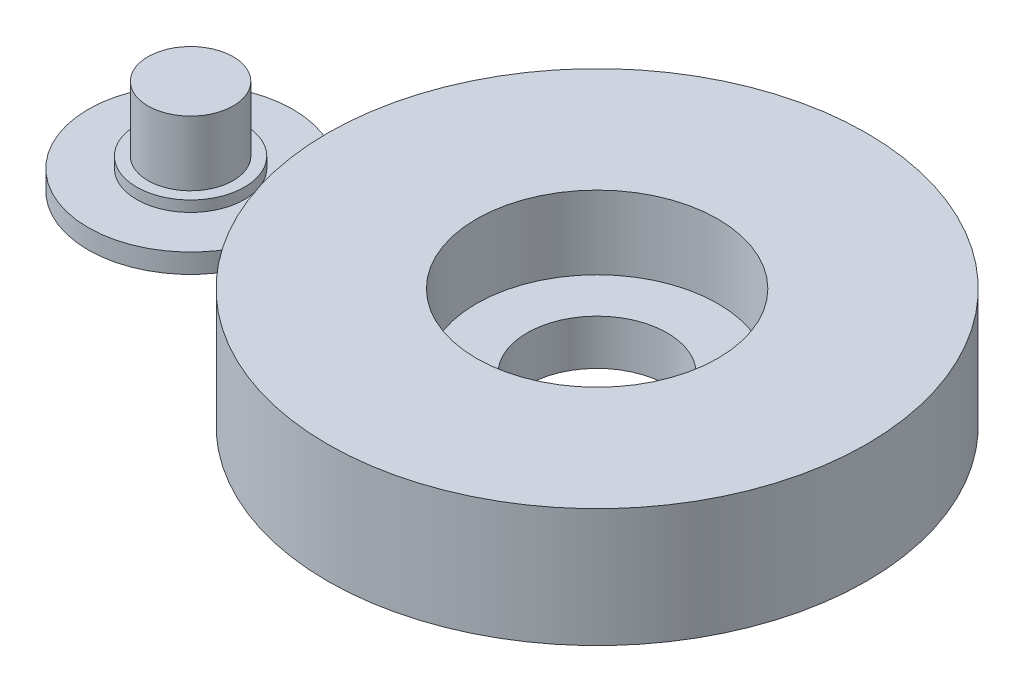
from build123d import *

# Parameters (mm, degrees)
SKETCH1_R           = 9.5
BOSS_EXTRUDE1_DEPTH = 1.8
SKETCH2_R           = 3.955
BOSS_EXTRUDE2_DEPTH = 7
SKETCH3_R           = 5
BOSS_EXTRUDE3_DEPTH = 1
SKETCH5_R           = 25
BOSS_EXTRUDE4_DEPTH = 11
SKETCH6_R           = 11.2
CUT_EXTRUDE1_DEPTH  = 6.8
SKETCH7_R           = 6.5
CUT_EXTRUDE2_DEPTH  = 6.8


with BuildPart() as part:
    # Sketch1 → Boss-Extrude1 (new body)
    with BuildSketch(Plane(origin=(0, 0, 0), x_dir=(1, 0, 0), z_dir=(0, 1, 0))):
        Circle(SKETCH1_R)
    extrude(amount=BOSS_EXTRUDE1_DEPTH)

    # Sketch2 → Boss-Extrude2 (add)
    with BuildSketch(Plane(origin=(0, 1.8, 0), x_dir=(1, 0, 0), z_dir=(0, 1, 0))):
        Circle(SKETCH2_R)
    extrude(amount=BOSS_EXTRUDE2_DEPTH)

    # Sketch3 → Boss-Extrude3 (add)
    with BuildSketch(Plane(origin=(0, 1.8, 0), x_dir=(1, 0, 0), z_dir=(0, 1, 0))):
        Circle(SKETCH3_R)
    extrude(amount=BOSS_EXTRUDE3_DEPTH)


with BuildPart() as body_2:
    # Sketch5 → Boss-Extrude4 (new body)
    with BuildSketch(Plane(origin=(0, 0, 0), x_dir=(1, 0, 0), z_dir=(0, 1, 0))):
        with Locations((37.713199052, 0)):
            Circle(SKETCH5_R)
    extrude(amount=BOSS_EXTRUDE4_DEPTH)

    # Sketch6 → Cut-Extrude1 (cut)
    with BuildSketch(Plane(origin=(0, 11, 0), x_dir=(1, 0, 0), z_dir=(0, 1, 0))):
        with Locations((37.713199052, 0)):
            Circle(SKETCH6_R)
    extrude(amount=-CUT_EXTRUDE1_DEPTH, mode=Mode.SUBTRACT)

    # Sketch7 → Cut-Extrude2 (cut)
    with BuildSketch(Plane(origin=(0, 4.2, 0), x_dir=(1, 0, 0), z_dir=(0, 1, 0))):
        with Locations((37.713199052, 0)):
            Circle(SKETCH7_R)
    extrude(amount=-CUT_EXTRUDE2_DEPTH, mode=Mode.SUBTRACT)


solid = Compound([part.part, body_2.part])
